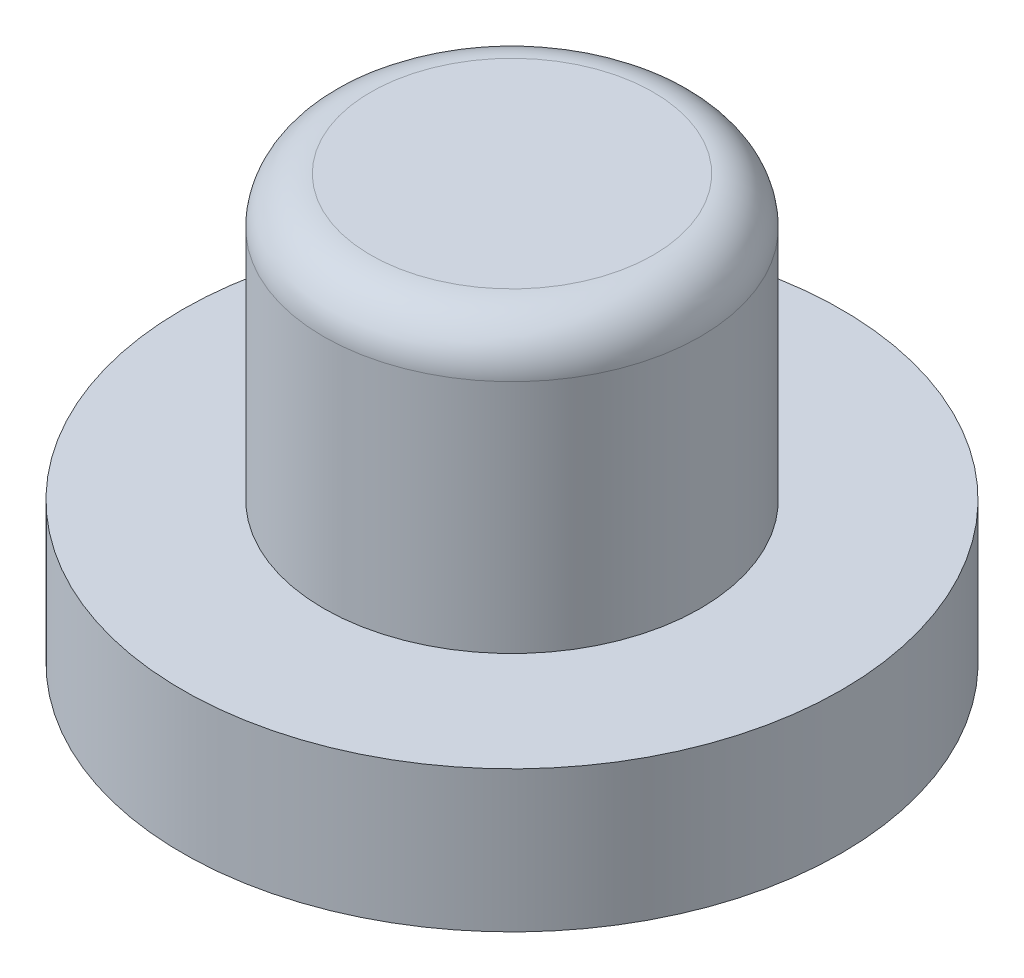
from build123d import *

# Parameters (mm, degrees)
SKETCH2_W          = 2.5
SKETCH2_H          = 3.5
CUT_EXTRUDE1_DEPTH = 3
CUT_EXTRUDE1_DRAFT = -8
FILLET1_R          = 1


with BuildPart() as part:
    # Sketch1 → Revolve1 (revolve)
    with BuildSketch(Plane.XY):
        Polygon((0, 9), (4, 9), (4, 3), (7, 3), (7, 0), (0, 0), align=None)
    revolve(axis=Axis((0, 9, 0), (0, -1, 0)))


with BuildPart() as cut_extrude1_tool:
    # Sketch2 → Cut-Extrude1 (with draft: the straight prism first)
    with BuildSketch(Plane.XZ):
        Rectangle(SKETCH2_W, SKETCH2_H)
    extrude(amount=-CUT_EXTRUDE1_DEPTH)
    # Cut-Extrude1: the draft: its side faces are tilted about the plane it starts from
    cut_extrude1_sides = [cut_extrude1_tool.faces().sort_by_distance(p)[0] for p in [
        (0, 1.5, -1.75),
        (1.25, 1.5, 0),
        (0, 1.5, 1.75),
        (-1.25, 1.5, 0),
    ]]
    draft(cut_extrude1_sides, Plane.XZ, CUT_EXTRUDE1_DRAFT)


with BuildPart() as part_1:
    add(part.part)

    # Cut-Extrude1: cut by cut_extrude1_tool
    add(cut_extrude1_tool.part, mode=Mode.SUBTRACT)

    # Fillet1
    fillet1_edges = [part_1.edges().sort_by_distance(p)[0] for p in [
        (-4, 9, 0),
    ]]
    fillet(fillet1_edges, radius=FILLET1_R)


solid = part_1.part
